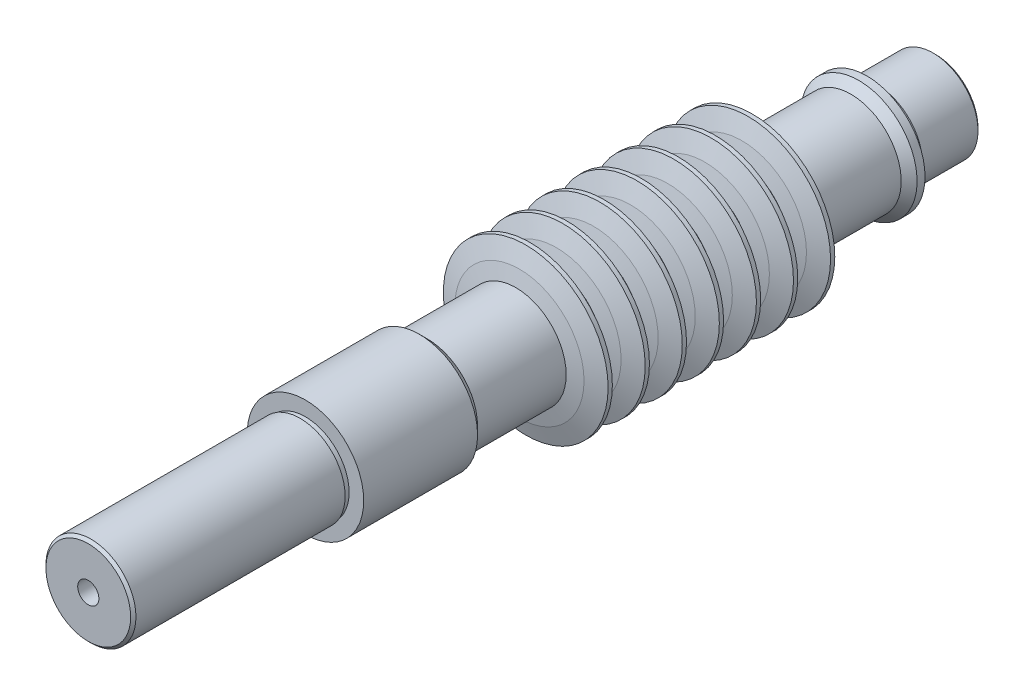
from build123d import *

# Parameters (mm, degrees)
SKETCH1_R       = 8.5
EXTRUDE1_DEPTH  = 11
SKETCH2_R       = 6.5
EXTRUDE2_DEPTH  = 2
SKETCH3_R       = 11
EXTRUDE3_DEPTH  = 3
SKETCH4_R       = 9.5
EXTRUDE4_DEPTH  = 80
SKETCH5_R       = 11
EXTRUDE5_DEPTH  = 23
SKETCH6_R       = 8.25
EXTRUDE6_DEPTH  = 1
SKETCH7_R       = 8.5
EXTRUDE7_DEPTH  = 40
CHAMFER1_SIZE   = 0.5
CHAMFER2_SIZE   = 1.5
SKETCH8_R       = 2
EXTRUDE8_DEPTH  = 6
CHAMFER3_SIZE   = 2
EXTRUDE9_START  = -6
SKETCH9_R       = 2
EXTRUDE9_DEPTH  = 6
CHAMFER4_SIZE   = 2
EXTRUDE11_DEPTH = 2
LPATTERN1_COUNT = 7
LPATTERN1_PITCH = 7


with BuildPart() as part:
    # Sketch1 → Extrude1 (new body)
    with BuildSketch(Plane.XY):
        Circle(SKETCH1_R)
    extrude(amount=EXTRUDE1_DEPTH)

    # Sketch2 → Extrude2 (add)
    with BuildSketch(Plane.XY.offset(11)):
        Circle(SKETCH2_R)
    extrude(amount=EXTRUDE2_DEPTH)

    # Sketch3 → Extrude3 (add)
    with BuildSketch(Plane.XY.offset(13)):
        Circle(SKETCH3_R)
    extrude(amount=EXTRUDE3_DEPTH)

    # Sketch4 → Extrude4 (add)
    with BuildSketch(Plane.XY.offset(16)):
        Circle(SKETCH4_R)
    extrude(amount=EXTRUDE4_DEPTH)

    # Sketch5 → Extrude5 (add)
    with BuildSketch(Plane.XY.offset(96)):
        Circle(SKETCH5_R)
    extrude(amount=EXTRUDE5_DEPTH)

    # Sketch6 → Extrude6 (add)
    with BuildSketch(Plane.XY.offset(119)):
        Circle(SKETCH6_R)
    extrude(amount=EXTRUDE6_DEPTH)

    # Sketch7 → Extrude7 (add)
    with BuildSketch(Plane.XY.offset(120)):
        Circle(SKETCH7_R)
    extrude(amount=EXTRUDE7_DEPTH)

    # Chamfer1
    chamfer1_edges = [part.edges().sort_by_distance(p)[0] for p in [
        (-8.5, 0, 0),
        (-8.5, 0, 160),
    ]]
    chamfer(chamfer1_edges, length=CHAMFER1_SIZE)

    # Chamfer2
    chamfer2_edges = [part.edges().sort_by_distance(p)[0] for p in [
        (-11, 0, 96),
        (-11, 0, 16),
    ]]
    chamfer(chamfer2_edges, length=CHAMFER2_SIZE - 0.0001)  # a hair under: the kernel refuses the full size

    # Sketch8 → Extrude8 (cut)
    with BuildSketch(Plane.XY.offset(160)):
        Circle(SKETCH8_R)
    extrude(amount=-EXTRUDE8_DEPTH, mode=Mode.SUBTRACT)

    # Chamfer3
    chamfer3_edges = [part.edges().sort_by_distance(p)[0] for p in [
        (-2, 0, 154),
    ]]
    chamfer(chamfer3_edges, length=CHAMFER3_SIZE)

    # Sketch9 → Extrude9 (cut)
    with BuildSketch(Plane(origin=(0, 0, 0), x_dir=(-1, 0, 0), z_dir=(0, 0, -1)).offset(EXTRUDE9_START)):
        with Locations(Location((0, 0, 0), (0, 0, 180))):
            Circle(SKETCH9_R)
    extrude(amount=EXTRUDE9_DEPTH, mode=Mode.SUBTRACT)

    # Chamfer4
    chamfer4_edges = [part.edges().sort_by_distance(p)[0] for p in [
        (-2, 0, 6),
    ]]
    chamfer(chamfer4_edges, length=CHAMFER4_SIZE)

    # Sketch10 → Extrude11 (cut)
    with BuildSketch(Plane(origin=(-8.5, 0, 0), x_dir=(0, 0, -1), z_dir=(1, 0, 0))):
        with BuildLine():
            Line((-125, -3), (-139, -3))
            ThreePointArc((-139, -3), (-142, 0), (-139, 3))
            Line((-139, 3), (-125, 3))
            ThreePointArc((-125, 3), (-122, 0), (-125, -3))
        make_face()
    extrude(amount=EXTRUDE11_DEPTH, mode=Mode.SUBTRACT)

    # Sketch11 → Revolve1 (revolve)
    with BuildSketch(Plane(origin=(0, 0, 0), x_dir=(1, 0, 0), z_dir=(0, 1, 0))):
        Polygon((9.5, -79.265), (9.5, -74.735), (12.198447959, -75.40961199), (15.56, -76.6), (15.56, -77.4), (12.198447959, -78.59038801), align=None)
    revolve1 = revolve(axis=Axis((0, 0, 84.014072954), (0, 0, -1)))

    # LPattern1: Revolve1 ×7
    with Locations(*[(0, 0, -i * LPATTERN1_PITCH) for i in range(1, LPATTERN1_COUNT)]):
        add(revolve1)


solid = part.part
